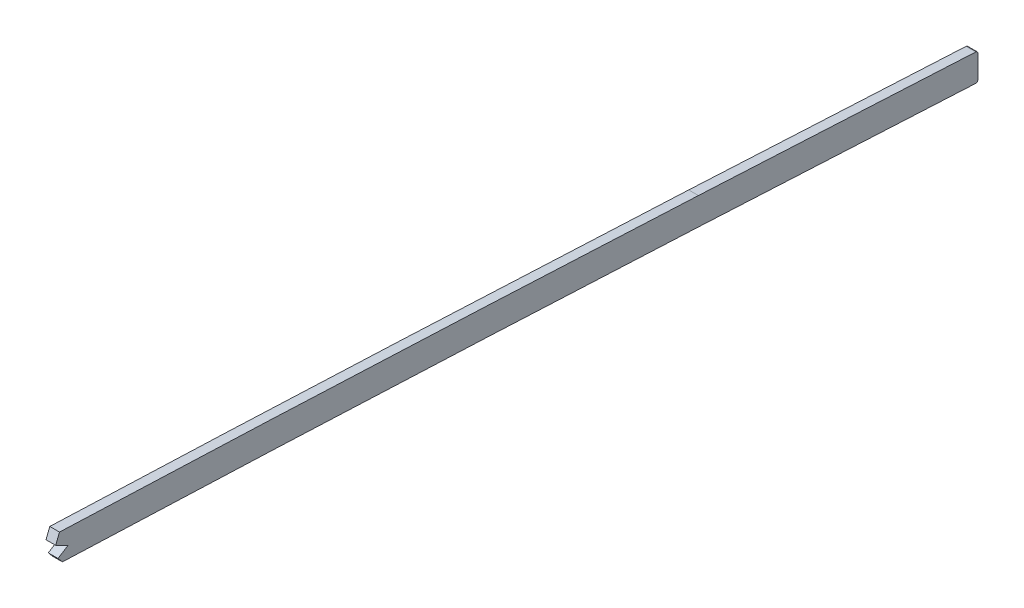
from build123d import *

# Parameters (mm, degrees)
BOSS_EXTRUDE1_START = -1.5875
BOSS_EXTRUDE1_DEPTH = 3.175
FILLET1_R           = 2.54
CUT_EXTRUDE1_DEPTH  = 2674.191025632
FILLET2_R           = 0.762
FILLET3_R           = 0.762
SKETCH5_W           = 636.742492472
SKETCH5_H           = 356.774003564
CUT_EXTRUDE2_DEPTH  = 7.62


with BuildPart() as part:
    # Boss-Extrude1: read off the stored shape, not the designer's step
    # Boss-Extrude1 outline → Boss-Extrude1 (new body)
    with BuildSketch(Plane(origin=(0, 0, 0), x_dir=(0, 0, -1), z_dir=(1, 0, 0)).offset(BOSS_EXTRUDE1_START)):
        with BuildLine():
            add(Edge.make_bspline(
                [(1110.404970926, 130.384545774), (1120.170834465, 130.370061323), (1139.703057908, 130.338772026), (1168.998370974, 130.277673039), (1198.290610395, 130.194386876), (1217.81419633, 130.113940836), (1227.576506903, 130.06508052)],
                knots=[0, 0, 0, 0, 0.25, 0.5, 0.75, 1, 1, 1, 1], degree=3))
            add(Edge.make_bspline(
                [(1227.576506903, 130.06508052), (1269.911205773, 129.853195249), (1333.427746701, 129.273373321), (1418.042208161, 127.449050563), (1502.665994832, 124.913583682), (1608.454176987, 120.803299479), (1693.070073331, 116.848243245), (1735.369787733, 114.744712179)],
                knots=[0, 0, 0, 0, 0.25, 0.375, 0.5, 0.75, 1, 1, 1, 1], degree=3))
            add(Edge.make_bspline(
                [(1735.369787733, 114.744712179), (1815.995940723, 110.735232018), (1936.906650462, 104.096364548), (2098.049485168, 94.18797875), (2198.694736725, 87.314638509), (2279.130413747, 81.114418931), (2339.412950304, 76.034076608), (2399.564054334, 70.28270545), (2479.570468264, 61.127378254), (2559.292087872, 49.650907614), (2626.797554585, 38.235484735), (2656.889518578, 32.788503969), (2667.159793662, 30.877771266), (2669.54, 30.432069924)],
                knots=[0, 0, 0, 0, 0.25, 0.375, 0.5, 0.5625, 0.625, 0.6875, 0.75, 0.875, 0.9375, 0.96241067, 0.969928536, 0.969928536, 0.969928536, 0.969928536], degree=3))
            Line((2669.54, 30.432069924), (2669.54, 39.476142465))
            add(Edge.make_bspline(
                [(1735.811334709, 123.623740069), (1776.138635499, 121.618292624), (1816.460281579, 119.500621806), (1897.093668675, 115.087561885), (1937.405638896, 112.792971084), (2018.018419045, 108.018366523), (2058.319512223, 105.539122976), (2138.903780144, 100.307240032), (2179.18739793, 97.555127955), (2239.586998714, 93.080168687), (2259.716280977, 91.529837622), (2289.900442602, 89.09084343), (2299.960179135, 88.258845039), (2320.076004566, 86.552861654), (2330.132100898, 85.678962223), (2350.239356518, 83.874334847), (2360.290489794, 82.943307484), (2380.385973971, 81.003183297), (2390.430065378, 79.993418555), (2420.547026195, 76.827577532), (2440.60648589, 74.533672955), (2480.675569568, 69.556278523), (2500.68715183, 66.874150811), (2540.654290207, 61.150246295), (2560.611026428, 58.109755646), (2600.475457131, 51.702465574), (2620.382967089, 48.337538888), (2650.028116889, 43.072156367), (2659.78844051, 41.29687683), (2669.54, 39.476142465)],
                knots=[0, 0, 0, 0, 0.125, 0.125, 0.25, 0.25, 0.375, 0.375, 0.5, 0.5, 0.5625, 0.5625, 0.59375, 0.59375, 0.625, 0.625, 0.65625, 0.65625, 0.6875, 0.6875, 0.75, 0.75, 0.8125, 0.8125, 0.875, 0.875, 0.9375, 0.9375, 0.968210768, 0.968210768, 0.968210768, 0.968210768], degree=3))
            add(Edge.make_bspline(
                [(1227.621000751, 138.954969175), (1248.807303679, 138.848931677), (1269.993583155, 138.701170252), (1312.363832348, 138.270664618), (1333.547719008, 137.987407832), (1375.912368189, 137.249274813), (1397.09309738, 136.7925677), (1439.451328259, 135.701855835), (1460.629010312, 135.069210584), (1502.979101161, 133.670541385), (1524.152152736, 132.907434339), (1566.494303759, 131.284732459), (1587.663166024, 130.423163385), (1651.164052809, 127.709123983), (1693.490421561, 125.728325331), (1735.811334709, 123.623740069)],
                knots=[0, 0, 0, 0, 0.125, 0.125, 0.25, 0.25, 0.375, 0.375, 0.5, 0.5, 0.625, 0.625, 0.75, 0.75, 1, 1, 1, 1], degree=3))
            add(Edge.make_bspline(
                [(1110.418156307, 139.274535996), (1129.952027249, 139.245563914), (1149.485893504, 139.211997476), (1188.553558893, 139.115899087), (1208.087346834, 139.052735015), (1227.621000751, 138.954969175)],
                knots=[0, 0, 0, 0, 0.5, 0.5, 1, 1, 1, 1], degree=3))
            add(Edge.make_bspline(
                [(768.740124165, 138.468408213), (782.976796045, 138.460280143), (797.213453801, 138.479500079), (825.686695051, 138.549690296), (839.923258916, 138.600062665), (868.396318956, 138.719026333), (882.632808962, 138.789607972), (911.105746117, 138.939594729), (925.342197007, 139.018479563), (953.81517223, 139.160090703), (968.051699178, 139.222241505), (996.524919377, 139.30995407), (1010.761605517, 139.335014039), (1039.234912871, 139.349647552), (1053.471562869, 139.340493535), (1081.944860968, 139.313691902), (1096.181508981, 139.29565137), (1110.418156307, 139.274535996)],
                knots=[0, 0, 0, 0, 0.125, 0.125, 0.25, 0.25, 0.375, 0.375, 0.5, 0.5, 0.625, 0.625, 0.75, 0.75, 0.875, 0.875, 1, 1, 1, 1], degree=3))
            add(Edge.make_bspline(
                [(630.778432202, 139.251437536), (653.771819614, 139.075315664), (676.765000849, 138.871740519), (711.255349111, 138.647690701), (722.752238945, 138.586174182), (745.746099074, 138.499784896), (757.243084259, 138.474972158), (768.740124165, 138.468408213)],
                knots=[0, 0, 0, 0, 0.5, 0.5, 0.75, 0.75, 1, 1, 1, 1], degree=3))
            add(Edge.make_bspline(
                [(604.514984259, 139.433685568), (609.940743136, 139.400696354), (618.695242427, 139.342071397), (627.449694696, 139.276935028), (630.778432202, 139.251437536)],
                knots=[0, 0, 0, 0, 0.619765686, 1, 1, 1, 1], degree=3))
            ThreePointArc((604.514984259, 139.433685568), (600.549356142, 139.457173081), (596.583720644, 139.479379304))
            add(Edge.make_bspline(
                [(436.133018826, 139.357176562), (449.50393779, 139.390650739), (462.874888934, 139.412366015), (489.61665939, 139.498555977), (502.987497127, 139.559076553), (529.729299233, 139.628029754), (543.100240501, 139.639230481), (569.84212102, 139.601013959), (583.212960696, 139.552035302), (596.583720644, 139.479379304)],
                knots=[0, 0, 0, 0, 0.25, 0.25, 0.5, 0.5, 0.75, 0.75, 1, 1, 1, 1], degree=3))
            add(Edge.make_bspline(
                [(432.263917423, 139.347117104), (433.553617637, 139.350567112), (434.843318039, 139.353947814), (436.133018826, 139.357176562)],
                knots=[0, 0, 0, 0, 1, 1, 1, 1], degree=3))
            add(Edge.make_bspline(
                [(420.316232014, 139.305761868), (422.413235913, 139.315186344), (426.395793967, 139.330351666), (430.378363115, 139.342073082), (432.263917423, 139.347117104)],
                knots=[0, 0, 0, 0, 0.526548575, 1, 1, 1, 1], degree=3))
            add(Edge.make_bspline(
                [(376.410119779, 138.75403864), (383.726317086, 138.935561778), (391.043801196, 139.055611797), (405.679602634, 139.224192856), (412.997895507, 139.272871444), (420.316232014, 139.305761868)],
                knots=[0, 0, 0, 0, 0.5, 0.5, 1, 1, 1, 1], degree=3))
            add(Edge.make_bspline(
                [(336.49221538, 137.002990798), (349.782924989, 137.88646357), (363.094318653, 138.423658969), (376.410119779, 138.75403864)],
                knots=[0, 0, 0, 0, 1, 1, 1, 1], degree=3))
            add(Edge.make_bspline(
                [(322.369488076, 135.928469458), (327.073374868, 136.333386449), (331.781331813, 136.689844531), (336.49221538, 137.002990798)],
                knots=[0, 0, 0, 0, 1, 1, 1, 1], degree=3))
            add(Edge.make_bspline(
                [(269.769949315, 129.47895505), (274.123387467, 130.231879276), (278.485668028, 130.925946417), (287.22796256, 132.196043087), (291.608626646, 132.771988738), (300.381777496, 133.818422146), (304.774579419, 134.288963443), (313.567800313, 135.154375086), (317.967903853, 135.549407043), (322.369488076, 135.928469458)],
                knots=[0, 0, 0, 0, 0.25, 0.25, 0.5, 0.5, 0.75, 0.75, 1, 1, 1, 1], degree=3))
            add(Edge.make_bspline(
                [(135.15718457, 90.054634926), (146.043739673, 94.375230064), (156.99891695, 98.504335222), (173.56622243, 104.322560697), (179.110932848, 106.199810145), (190.24859245, 109.819698901), (195.841545849, 111.562316625), (207.065472514, 114.901345648), (212.697969124, 116.49836249), (224.005973618, 119.540534541), (229.683240596, 120.9862349), (246.767187276, 125.077694043), (258.225188059, 127.482295924), (269.769949315, 129.47895505)],
                knots=[0, 0, 0, 0, 0.25, 0.25, 0.375, 0.375, 0.5, 0.5, 0.625, 0.625, 0.75, 0.75, 1, 1, 1, 1], degree=3))
            add(Edge.make_bspline(
                [(107.049744533, 78.466050261), (116.373258882, 82.438606419), (125.737350123, 86.316143859), (135.15718457, 90.054634926)],
                knots=[0, 0, 0, 0, 1, 1, 1, 1], degree=3))
            add(Edge.make_bspline(
                [(99.06, 75.03568963), (99.223542669, 75.106424562), (100.635498802, 75.716852689), (103.297453866, 76.863328103), (105.798503999, 77.932922637), (107.049744533, 78.466050261)],
                knots=[0.484151133, 0.484151133, 0.484151133, 0.484151133, 0.515864471, 0.757931449, 1, 1, 1, 1], degree=3))
            Line((99.06, 75.03568963), (99.06, 65.345043949))
            add(Edge.make_bspline(
                [(99.06, 65.345043949), (99.380370965, 65.484464523), (100.637671455, 66.031176319), (103.17753745, 67.132002814), (106.681577323, 68.64166857), (109.249580285, 69.740028797), (110.534459652, 70.287489229)],
                knots=[0.254738807, 0.254738807, 0.254738807, 0.254738807, 0.317238807, 0.5, 0.75, 1, 1, 1, 1], degree=3))
            add(Edge.make_bspline(
                [(110.534459652, 70.287489229), (112.850658013, 71.274373329), (117.489277519, 73.236837099), (124.456688526, 76.138068453), (131.438476528, 78.994265342), (136.101204469, 80.864754132), (138.436571012, 81.791601309)],
                knots=[0, 0, 0, 0, 0.25, 0.5, 0.75, 1, 1, 1, 1], degree=3))
            add(Edge.make_bspline(
                [(138.436571012, 81.791601309), (143.826897197, 83.930883835), (154.6522834, 88.11877139), (176.408203186, 96.037596764), (203.906835742, 104.998187521), (237.39469787, 114.027149543), (259.934818065, 118.755998441), (271.284977744, 120.719001348)],
                knots=[0, 0, 0, 0, 0.125, 0.25, 0.5, 0.75, 1, 1, 1, 1], degree=3))
            add(Edge.make_bspline(
                [(271.284977744, 120.719001348), (275.558711595, 121.458140765), (284.124297478, 122.821139095), (297.036360548, 124.518896272), (310.018420247, 125.909880891), (318.766623126, 126.695286194), (323.13209925, 127.071239405)],
                knots=[5e-09, 5e-09, 5e-09, 5e-09, 0.2499992, 0.4999984, 0.7499976, 0.999996801, 0.999996801, 0.999996801, 0.999996801], degree=3))
            add(Edge.make_bspline(
                [(323.13209925, 127.071239405), (324.293050056, 127.171175344), (326.615168427, 127.365043892), (330.101568176, 127.638529754), (333.590184216, 127.895089457), (335.917953069, 128.055198639), (337.081858513, 128.132566852)],
                knots=[1.2024e-05, 1.2024e-05, 1.2024e-05, 1.2024e-05, 0.250009018, 0.500006012, 0.750003006, 1, 1, 1, 1], degree=3))
            add(Edge.make_bspline(
                [(337.081858513, 128.132566852), (340.367862287, 128.350997241), (346.939906877, 128.744909116), (356.821319657, 129.221190111), (366.716250393, 129.595096292), (373.326613137, 129.784797569), (376.630622597, 129.866773678)],
                knots=[0, 0, 0, 0, 0.25, 0.5, 0.75, 1, 1, 1, 1], degree=3))
            add(Edge.make_bspline(
                [(376.630622597, 129.866773678), (380.266394474, 129.956981294), (387.534764147, 130.106779908), (398.462206547, 130.259361028), (409.400972015, 130.358727994), (416.705417778, 130.39944419), (420.356185481, 130.415851648)],
                knots=[0, 0, 0, 0, 0.25, 0.5, 0.75, 1, 1, 1, 1], degree=3))
            add(Edge.make_bspline(
                [(420.356185481, 130.415851648), (421.350045129, 130.420318309), (423.337533562, 130.428603137), (426.320174328, 130.439402209), (429.303468332, 130.448883952), (431.293011648, 130.454488038), (432.287698861, 130.457148912)],
                knots=[0, 0, 0, 0, 0.25, 0.5, 0.75, 1, 1, 1, 1], degree=3))
            add(Edge.make_bspline(
                [(432.287698861, 130.457148912), (432.610032304, 130.45801117), (433.254717136, 130.45972707), (434.221637716, 130.462266911), (435.188505114, 130.464765142), (435.833012253, 130.466397641), (436.155274747, 130.46720442)],
                knots=[9.2e-08, 9.2e-08, 9.2e-08, 9.2e-08, 0.25, 0.5, 0.75, 1, 1, 1, 1], degree=3))
            add(Edge.make_bspline(
                [(436.155274747, 130.46720442), (449.528322363, 130.500683927), (476.275740382, 130.546633815), (516.38896029, 130.728798697), (556.456290895, 130.759667498), (583.176533448, 130.662101975), (596.535396133, 130.589510646)],
                knots=[0, 0, 0, 0, 0.249999973, 0.499999946, 0.749999918, 0.999999891, 0.999999891, 0.999999891, 0.999999891], degree=3))
            ThreePointArc((596.535396133, 130.589510646), (600.498158983, 130.567320504), (604.460914457, 130.543849998))
            add(Edge.make_bspline(
                [(604.460914457, 130.543849998), (606.648150431, 130.530551362), (611.022503017, 130.502867011), (617.584689429, 130.458405465), (624.147187284, 130.411339888), (628.522663802, 130.378455494), (630.7103385, 130.361698324)],
                knots=[-7.09e-07, -7.09e-07, -7.09e-07, -7.09e-07, 0.249999468, 0.499999646, 0.749999823, 1, 1, 1, 1], degree=3))
            add(Edge.make_bspline(
                [(630.7103385, 130.361698324), (642.206126489, 130.273644326), (665.193556095, 130.083785311), (699.699077953, 129.819212193), (734.21504011, 129.634735151), (757.228597075, 129.58497898), (768.735048644, 129.578409662)],
                knots=[0, 0, 0, 0, 0.25, 0.5, 0.75, 1, 1, 1, 1], degree=3))
            add(Edge.make_bspline(
                [(768.735048644, 129.578409662), (797.222409768, 129.56214552), (854.203652026, 129.725124503), (939.635195481, 130.236578518), (1024.992958464, 130.524931921), (1081.937612336, 130.426767717), (1110.404970926, 130.384545774)],
                knots=[0, 0, 0, 0, 0.25, 0.5, 0.75, 1, 1, 1, 1], degree=3))
        make_face()
    extrude(amount=BOSS_EXTRUDE1_DEPTH)

    # Fillet1
    fillet1_edges = [part.edges().sort_by_distance(p)[0] for p in [
        (0, 39.476142465, -2669.54),
        (0, 30.432069924, -2669.54),
        (0, 65.345043949, -99.06),
        (0, 75.03568963, -99.06),
    ]]
    fillet(fillet1_edges, radius=FILLET1_R)

    # Sketch4 → Cut-Extrude1 (cut, through all)
    with BuildSketch(Plane(origin=(1.5875, 0, 0), x_dir=(0, 0, -1), z_dir=(1, 0, 0))):
        Polygon((1827.2125, 118.895836595), (1827.2125, 110.000384115), (1827.2125, 78.791710134), (2135.1875, 78.791710134), (2135.1875, 91.599357392), (2135.1875, 100.508307819), (2135.1875, 129.353842083), (1827.2125, 129.353842083), align=None)
    extrude(amount=-CUT_EXTRUDE1_DEPTH, mode=Mode.SUBTRACT)


with BuildPart() as cut_extrude1_piece_1:
    # of the separate pieces the step leaves, piece 1, a body of its own (cut_extrude1_pieces)
    add(part.part.solids().sort_by_distance((-1.5875, 114.744712179, -1735.369787733))[0])

    # Fillet2
    fillet2_edges = [cut_extrude1_piece_1.edges().sort_by_distance(p)[0] for p in [
        (0, 118.895836595, -1827.2125),
        (0, 110.000384116, -1827.2125),
    ]]
    fillet(fillet2_edges, radius=FILLET2_R)


with BuildPart() as cut_extrude1_piece_2:
    # of the separate pieces the step leaves, piece 2, a body of its own (cut_extrude1_pieces)
    add(part.part.solids().sort_by_distance((-1.5875, 91.599357392, -2135.1875))[0])

    # Fillet3
    fillet3_edges = [cut_extrude1_piece_2.edges().sort_by_distance(p)[0] for p in [
        (0, 100.508307819, -2135.1875),
        (0, 91.599357392, -2135.1875),
    ]]
    fillet(fillet3_edges, radius=FILLET3_R)


with BuildPart() as cut_extrude2_tool:
    # Sketch5 → Cut-Extrude2 (new body)
    with BuildSketch(Plane(origin=(1.5875, 0, 0), x_dir=(0, 0, -1), z_dir=(1, 0, 0))):
        Polygon((1526.921002642, 132.788776067), (1525.689431031, 129.632745348), (1529.671392187, 127.575945218), (1526.428351657, 125.564439067), (1528.398437884, 123.245298517), (1528.398437884, 118.623114405), (-69.434984225, -369.526535585), (-528.734858547, 275.104866971), (1526.921002642, 184.452057857), align=None)
        with Locations((2399.198239347, 52.922681549)):
            Rectangle(SKETCH5_W, SKETCH5_H)
    extrude(amount=-CUT_EXTRUDE2_DEPTH)


with BuildPart() as cut_extrude1_piece_1_1:
    add(cut_extrude1_piece_1.part)

    # Cut-Extrude2: cut by cut_extrude2_tool
    add(cut_extrude2_tool.part, mode=Mode.SUBTRACT)


with BuildPart() as cut_extrude1_piece_2_1:
    add(cut_extrude1_piece_2.part)

    # Cut-Extrude2: cut by cut_extrude2_tool
    add(cut_extrude2_tool.part, mode=Mode.SUBTRACT)


solid = cut_extrude1_piece_1_1.part
